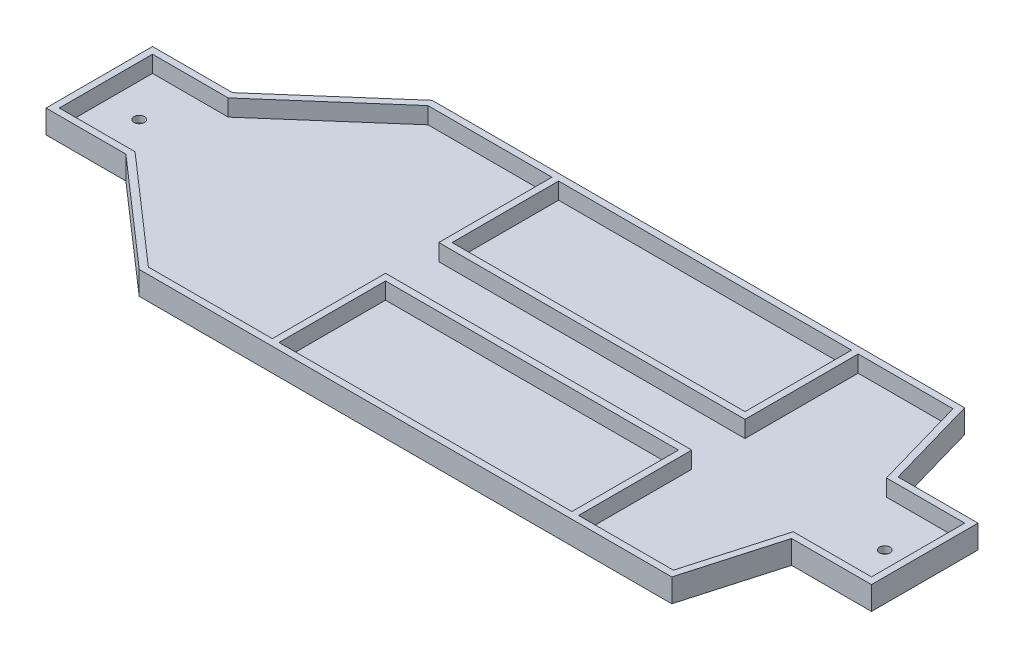
from build123d import *

# Parameters (mm, degrees)
SKETCH1_R           = 2.4892
BOSS_EXTRUDE1_DEPTH = 3.175
SKETCH1_3_W         = 139.7
SKETCH1_3_H         = 50.8
BOSS_EXTRUDE2_DEPTH = 11.1125


with BuildPart() as part:
    # Sketch1 → Boss-Extrude1 (new body)
    with BuildSketch(Plane(origin=(0, 0, 0), x_dir=(1, 0, 0), z_dir=(0, 1, 0))):
        Polygon((-127, 69.85), (-177.8, 25.4), (-215.9, 25.4), (-215.9, -25.4), (-177.8, -25.4), (-127, -69.85), (127, -69.85), (139.7, -25.4), (177.8, -25.4), (177.8, 25.4), (139.7, 25.4), (127, 69.85), align=None)
        with Locations((158.75, 0)):
            Circle(SKETCH1_R, mode=Mode.SUBTRACT)
        with Locations((-196.85, 0)):
            Circle(SKETCH1_R, mode=Mode.SUBTRACT)
    extrude(amount=BOSS_EXTRUDE1_DEPTH)

    # Sketch1<3> → Boss-Extrude2 (add)
    with BuildSketch(Plane(origin=(0, 0, 0), x_dir=(1, 0, 0), z_dir=(0, 1, 0))):
        Polygon((-127, 69.85), (-177.8, 25.4), (-215.9, 25.4), (-215.9, -25.4), (-177.8, -25.4), (-127, -69.85), (127, -69.85), (139.7, -25.4), (177.8, -25.4), (177.8, 25.4), (139.7, 25.4), (127, 69.85), align=None)
        Polygon((-125.807041006, 66.675), (-66.675, 66.675), (-66.675, 12.7), (79.375, 12.7), (79.375, 66.675), (124.605093015, 66.675), (137.305093015, 22.225), (174.625, 22.225), (174.625, -22.225), (137.305093015, -22.225), (124.605093015, -66.675), (79.375, -66.675), (79.375, -12.7), (-66.675, -12.7), (-66.675, -66.675), (-125.807041006, -66.675), (-176.607041006, -22.225), (-212.725, -22.225), (-212.725, 22.225), (-176.607041006, 22.225), align=None, mode=Mode.SUBTRACT)
        with Locations((6.35, 41.275)):
            Rectangle(SKETCH1_3_W, SKETCH1_3_H, mode=Mode.SUBTRACT)
        with Locations((6.35, -41.275)):
            Rectangle(SKETCH1_3_W, SKETCH1_3_H, mode=Mode.SUBTRACT)
    extrude(amount=BOSS_EXTRUDE2_DEPTH)


solid = part.part
